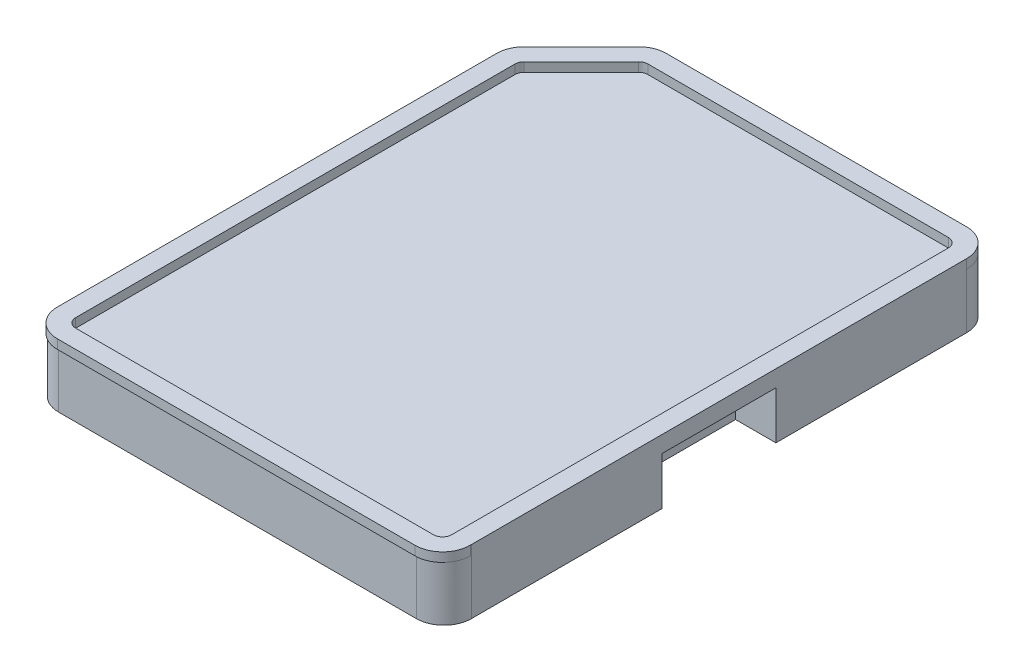
from build123d import *

# Parameters (mm, degrees)
BODY_DEPTH             = 3
MAGNET_CUTOUT_SKETCH_W = 2.2
MAGNET_CUTOUT_SKETCH_H = 6.2
MAGNET_CUTOUT_DEPTH    = 2.6
BORDER_DEPTH           = 0.5
FILLET_1_R             = 1.5


with BuildPart() as part:
    # surface_sketch → body (new body)
    with BuildSketch(Plane(origin=(0, 0, 0), x_dir=(1, 0, 0), z_dir=(0, 1, 0))):
        Polygon((-12.4, -15), (10.1, -15), (10.1, 15), (-8.4, 15), (-12.4, 11), align=None)
    extrude(amount=-BODY_DEPTH)

    # magnet_cutout_sketch → magnet_cutout (cut)
    with BuildSketch(Plane.XZ.offset(3)):
        with Locations((9, 0)):
            Rectangle(MAGNET_CUTOUT_SKETCH_W, MAGNET_CUTOUT_SKETCH_H)
    magnet_cutout = extrude(amount=-MAGNET_CUTOUT_DEPTH, mode=Mode.SUBTRACT)

    # magnet_cutout_mirror: magnet_cutout across plane
    add(magnet_cutout.mirror(Plane(origin=(-1.15, 0, 0), x_dir=(0, 0, 1), z_dir=(1, 0, 0))), mode=Mode.SUBTRACT)

    # border_sketch → border (add)
    with BuildSketch(Plane(origin=(0, 0, 0), x_dir=(1, 0, 0), z_dir=(0, 1, 0))):
        with BuildLine():
            Line((-7.778679656, 15), (8.6, 15))
            ThreePointArc((8.6, 15), (9.660660172, 14.560660172), (10.1, 13.5))
            Line((10.1, 13.5), (10.1, -13.571428571))
            ThreePointArc((10.1, -13.571428571), (9.660660172, -14.632088743), (8.6, -15.071428571))
            Line((8.6, -15.071428571), (-10.9, -15.071428571))
            ThreePointArc((-10.9, -15.071428571), (-11.960660172, -14.632088743), (-12.4, -13.571428571))
            Line((-12.4, -13.571428571), (-12.4, 10.378679656))
            ThreePointArc((-12.4, 10.378679656), (-12.285819299, 10.952704805), (-11.960660172, 11.439339828))
            Line((-11.960660172, 11.439339828), (-8.839339828, 14.560660172))
            ThreePointArc((-8.839339828, 14.560660172), (-8.352704805, 14.885819299), (-7.778679656, 15))
        make_face()
        with BuildLine():
            Line((-7.778679656, 14), (8.6, 14))
            ThreePointArc((8.6, 14), (8.953553391, 13.853553391), (9.1, 13.5))
            Line((9.1, 13.5), (9.1, -13.571428571))
            ThreePointArc((9.1, -13.571428571), (8.953553391, -13.924981962), (8.6, -14.071428571))
            Line((8.6, -14.071428571), (-10.9, -14.071428571))
            ThreePointArc((-10.9, -14.071428571), (-11.253553391, -13.924981962), (-11.4, -13.571428571))
            Line((-11.4, -13.571428571), (-11.4, 10.378679656))
            ThreePointArc((-11.4, 10.378679656), (-11.361939766, 10.570021373), (-11.253553391, 10.732233047))
            Line((-11.253553391, 10.732233047), (-8.132233047, 13.853553391))
            ThreePointArc((-8.132233047, 13.853553391), (-7.970021373, 13.961939766), (-7.778679656, 14))
        make_face(mode=Mode.SUBTRACT)
    extrude(amount=BORDER_DEPTH)

    # Скругление1
    # the kernel refuses this fillet: 1.5 mm, written as the material it takes off along each edge
    with BuildSketch(Plane(origin=(10.1, 3.75, 15), x_dir=(-1, 0, 0), z_dir=(0, -1, 0))) as fillet_1_piece_1_section:
        with BuildLine():
            CenterArc((FILLET_1_R, FILLET_1_R), FILLET_1_R, 180, 90)
            Line((0, FILLET_1_R), (0, 0))
            Line((0, 0), (FILLET_1_R, 0))
        make_face()
    fillet_1_piece_1 = extrude(amount=10.5, mode=Mode.PRIVATE)
    fillet_1_piece_1 = fillet_1_piece_1 - Plane(origin=(8.6, 0.25, 13.571428571), x_dir=(1, 0, 0), z_dir=(0, -1, 0)) * Cylinder(1.5, 27, mode=Mode.PRIVATE)
    add(fillet_1_piece_1, mode=Mode.SUBTRACT)
    with BuildSketch(Plane(origin=(10.1, 0, 15), x_dir=(-1, 0, 0), z_dir=(0, -1, 0))) as fillet_1_piece_2:
        with BuildLine():
            CenterArc((FILLET_1_R, FILLET_1_R), FILLET_1_R, 180, 90)
            Line((0, FILLET_1_R), (0, 0))
            Line((0, 0), (FILLET_1_R, 0))
        make_face()
    extrude(amount=6.75, mode=Mode.SUBTRACT)
    with BuildSketch(Plane(origin=(10.1, 3.75, -15), x_dir=(0, 0, 1), z_dir=(0, -1, 0))) as fillet_1_piece_3:
        with BuildLine():
            CenterArc((FILLET_1_R, FILLET_1_R), FILLET_1_R, 180, 90)
            Line((0, FILLET_1_R), (0, 0))
            Line((0, 0), (FILLET_1_R, 0))
        make_face()
    extrude(amount=10.5, mode=Mode.SUBTRACT)
    with BuildSketch(Plane(origin=(-12.4, 3.75, 15), x_dir=(1, 0, 0), z_dir=(0, -1, 0))) as fillet_1_piece_4_section:
        with BuildLine():
            CenterArc((FILLET_1_R, -FILLET_1_R), FILLET_1_R, 90, 90)
            Line((0, -FILLET_1_R), (0, 0))
            Line((0, 0), (FILLET_1_R, 0))
        make_face()
    fillet_1_piece_4 = extrude(amount=10.5, mode=Mode.PRIVATE)
    fillet_1_piece_4 = fillet_1_piece_4 - Plane(origin=(-10.9, 0.25, 13.571428571), x_dir=(0, 0, 1), z_dir=(0, -1, 0)) * Cylinder(1.5, 27, mode=Mode.PRIVATE)
    add(fillet_1_piece_4, mode=Mode.SUBTRACT)
    with BuildSketch(Plane(origin=(-12.4, 0, 15), x_dir=(1, 0, 0), z_dir=(0, -1, 0))) as fillet_1_piece_5:
        with BuildLine():
            CenterArc((FILLET_1_R, -FILLET_1_R), FILLET_1_R, 90, 90)
            Line((0, -FILLET_1_R), (0, 0))
            Line((0, 0), (FILLET_1_R, 0))
        make_face()
    extrude(amount=6.75, mode=Mode.SUBTRACT)
    with BuildSketch(Plane(origin=(-8.4, 1.553300859, -15), x_dir=(-0.7071067811865476, 0, 0.7071067811865476), z_dir=(0, -1, 0)), Plane(origin=(-12.4, 1.553300859, -11), x_dir=(0, 0, 1), z_dir=(0, -1, 0))) as fillet_1_piece_6:
        with BuildLine():
            CenterArc((FILLET_1_R * 0.414213562373, -FILLET_1_R), FILLET_1_R, 90, 45)
            Line((-FILLET_1_R * 0.292893218813, -FILLET_1_R * 0.292893218813), (0, 0))
            Line((0, 0), (FILLET_1_R * 0.414213562373, 0))
        make_face()
    extrude(amount=6.106601718, mode=Mode.SUBTRACT)


solid = part.part
